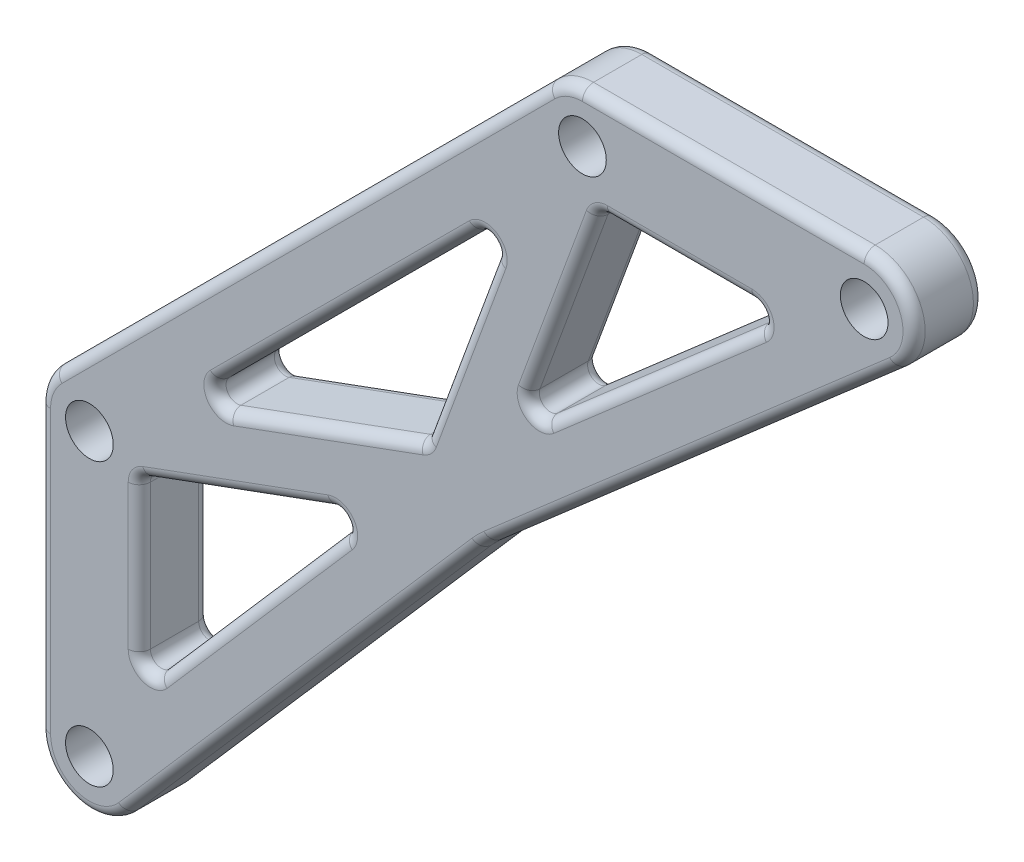
from build123d import *

# Parameters (mm, degrees)
SKETCH1_R           = 2.15
BOSS_EXTRUDE1_DEPTH = 6.35
FILLET1_R           = 1
FILLET2_R           = 10
FILLET3_R           = 1


with BuildPart() as part:
    # Sketch1 → Boss-Extrude1 (new body)
    with BuildSketch(Plane.XY):
        with BuildLine():
            Line((41.268019485, 73.031980515), (-3.181980515, 28.581980515))
            ThreePointArc((-3.181980515, 28.581980515), (-4.157457896, 27.122075446), (-4.5, 25.4))
            Line((-4.5, 25.4), (-4.5, 0))
            ThreePointArc((-4.5, 0), (-1.577770571, -4.214337436), (3.393617788, -2.955225593))
            Line((3.393617788, -2.955225593), (35.702961005, 34.147038995))
            Line((35.702961005, 34.147038995), (72.805225593, 66.456382212))
            ThreePointArc((72.805225593, 66.456382212), (74.064337436, 71.427770571), (69.85, 74.35))
            Line((69.85, 74.35), (44.45, 74.35))
            ThreePointArc((44.45, 74.35), (42.727924554, 74.007457896), (41.268019485, 73.031980515))
        make_face()
        Polygon((4.5, 7.451640951), (4.5, 23.856291875), (25.498859745, 31.565571248), align=None, mode=Mode.SUBTRACT)
        Polygon((30.175813365, 39.674186635), (8.401557674, 31.68023733), (38.16976267, 61.448442326), align=None, mode=Mode.SUBTRACT)
        Polygon((38.284428752, 44.351140255), (45.993708125, 65.35), (62.398359049, 65.35), align=None, mode=Mode.SUBTRACT)
        with Locations((0, 25.4)):
            Circle(SKETCH1_R, mode=Mode.SUBTRACT)
        with Locations((44.45, 69.85)):
            Circle(SKETCH1_R, mode=Mode.SUBTRACT)
        with Locations((69.85, 69.85)):
            Circle(SKETCH1_R, mode=Mode.SUBTRACT)
        Circle(SKETCH1_R, mode=Mode.SUBTRACT)
    extrude(amount=BOSS_EXTRUDE1_DEPTH)

    # Fillet1
    fillet1_edges = [part.edges().sort_by_distance(p)[0] for p in [
        (62.398359049, 65.35, 3.175),
        (38.284428752, 44.351140255, 3.175),
        (45.993708125, 65.35, 3.175),
        (30.175813365, 39.674186635, 3.175),
        (38.16976267, 61.448442326, 3.175),
        (8.401557674, 31.68023733, 3.175),
        (25.498859745, 31.565571248, 3.175),
        (4.5, 7.451640951, 3.175),
        (4.5, 23.856291875, 3.175),
    ]]
    fillet(fillet1_edges, radius=FILLET1_R)

    # Fillet2
    fillet2_edges = [part.edges().sort_by_distance(p)[0] for p in [
        (35.702961005, 34.147038995, 3.175),
    ]]
    fillet(fillet2_edges, radius=FILLET2_R)

    # Fillet3
    fillet3_edges = [part.edges().sort_by_distance(p)[0] for p in [
        (23.009675211, 29.851292292, 0),
        (14.597183023, 19.046688042, 0),
        (5.149384317, 9.186192659, 0),
        (4.5, 16.640435176, 0),
        (4.68004977, 23.730593079, 0),
        (30.103723379, 39.746276621, 0),
        (21.202633056, 36.379876625, 0),
        (11.476733814, 33.645368172, 0),
        (23.285660172, 46.564339828, 0),
        (36.204631828, 58.373266186, 0),
        (39.998707708, 46.840324789, 0),
        (42.690135952, 56.351591025, 0),
        (46.119406921, 65.16995023, 0),
        (53.209564824, 65.35, 0),
        (60.663807341, 64.700615683, 0),
        (74.064337436, 71.427770571, 0),
        (57.15, 74.35, 0),
        (42.727924554, 74.007457896, 0),
        (19.043019485, 50.806980515, 0),
        (-4.157457896, 27.122075446, 0),
        (-4.5, 12.7, 0),
        (-1.577770571, -4.214337436, 0),
        (19.321555564, 15.335538095, 0),
        (35.71979839, 34.13020161, 0),
        (23.009675211, 29.851292292, 6.35),
        (14.597183023, 19.046688042, 6.35),
        (5.149384317, 9.186192659, 6.35),
        (4.5, 16.640435176, 6.35),
        (4.68004977, 23.730593079, 6.35),
        (46.119406921, 65.16995023, 6.35),
        (53.209564824, 65.35, 6.35),
        (60.663807341, 64.700615683, 6.35),
        (50.803311958, 55.252816977, 6.35),
        (39.998707708, 46.840324789, 6.35),
        (36.204631828, 58.373266186, 6.35),
        (33.470123375, 48.647366944, 6.35),
        (30.103723379, 39.746276621, 6.35),
        (21.202633056, 36.379876625, 6.35),
        (11.476733814, 33.645368172, 6.35),
        (-4.157457896, 27.122075446, 6.35),
        (-4.5, 12.7, 6.35),
        (-1.577770571, -4.214337436, 6.35),
        (19.321555564, 15.335538095, 6.35),
        (35.71979839, 34.13020161, 6.35),
        (54.514461905, 50.528444436, 6.35),
        (74.064337436, 71.427770571, 6.35),
        (57.15, 74.35, 6.35),
        (42.727924554, 74.007457896, 6.35),
        (13.498408975, 27.159864048, 0),
        (33.470123375, 48.647366944, 0),
        (50.803311958, 55.252816977, 0),
        (54.514461905, 50.528444436, 0),
        (13.498408975, 27.159864048, 6.35),
        (42.690135952, 56.351591025, 6.35),
        (23.285660172, 46.564339828, 6.35),
        (19.043019485, 50.806980515, 6.35),
    ]]
    fillet(fillet3_edges, radius=FILLET3_R)


solid = part.part
